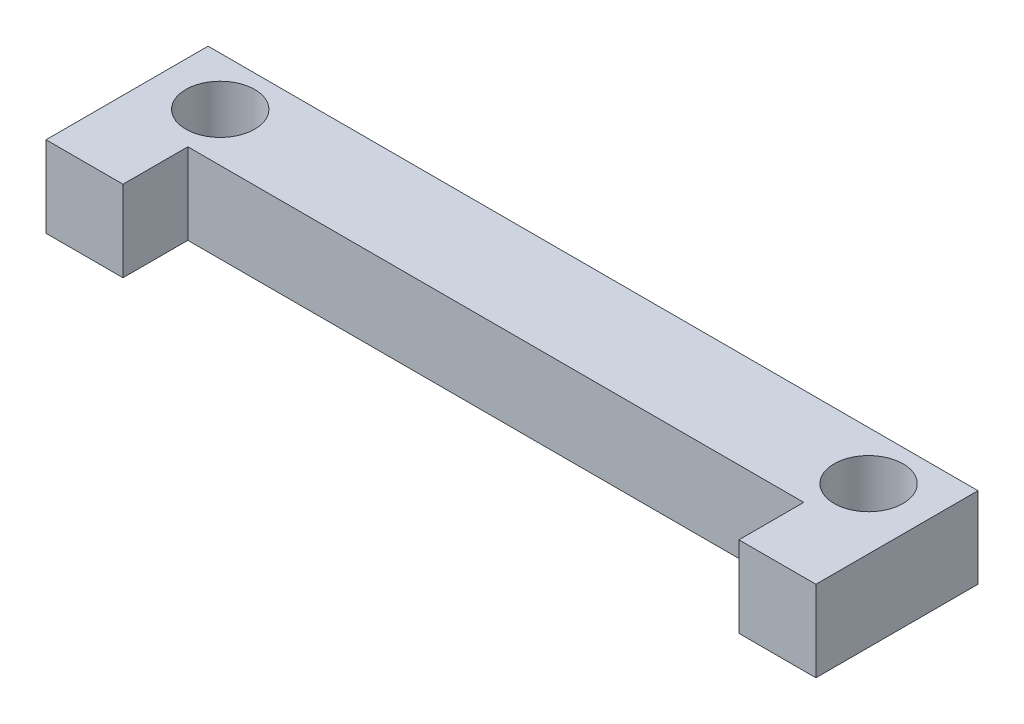
from build123d import *

# Parameters (mm, degrees)
SKETCH1_R           = 4.25
BOSS_EXTRUDE1_DEPTH = 10


with BuildPart() as part:
    # Sketch1 → Boss-Extrude1 (new body)
    with BuildSketch(Plane(origin=(0, 0, 0), x_dir=(1, 0, 0), z_dir=(0, 1, 0))):
        Polygon((-47.5, 12), (47.5, 12), (47.5, 0), (47.5, -8), (38, -8), (38, 0), (-38, 0), (-38, -8), (-47.5, -8), align=None)
        with Locations((-40, 6)):
            Circle(SKETCH1_R, mode=Mode.SUBTRACT)
        with Locations((40, 6)):
            Circle(SKETCH1_R, mode=Mode.SUBTRACT)
    extrude(amount=BOSS_EXTRUDE1_DEPTH)


solid = part.part
